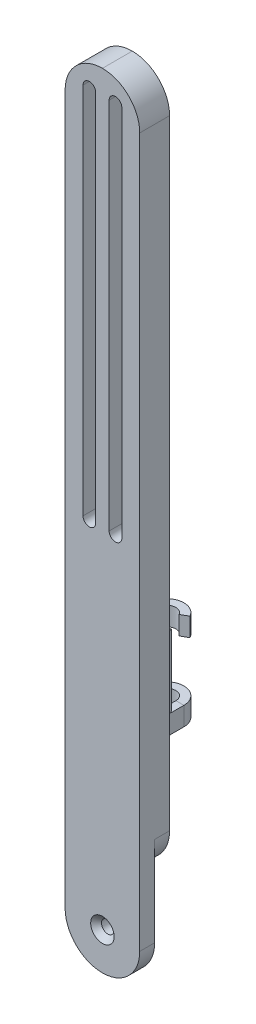
from build123d import *

# Parameters (mm, degrees)
BOSS_EXTRUDE1_DEPTH                                 = 8
FILLET1_R                                           = 10
CUT_EXTRUDE8_DEPTH                                  = 4
CSK_FOR_M3_COUNTERSUNK_FLAT_HEAD_SCREW2_D           = 3.4
CSK_FOR_M3_COUNTERSUNK_FLAT_HEAD_SCREW2_DEPTH       = 8.5
CSK_FOR_M3_COUNTERSUNK_FLAT_HEAD_SCREW2_CSINK_D     = 6.3
CSK_FOR_M3_COUNTERSUNK_FLAT_HEAD_SCREW2_CSINK_ANGLE = 90
CSK_FOR_M3_COUNTERSUNK_FLAT_HEAD_SCREW2_TIP         = 1.021463052
SKETCH14_W                                          = 9
SKETCH14_H                                          = 24.3
BOSS_EXTRUDE2_DEPTH                                 = 2
FILLET3_R                                           = 1.65
BOSS_EXTRUDE3_REACH                                 = 112.905
SKETCH16_W                                          = 2.15
SKETCH16_H                                          = 5
SKETCH18_W                                          = 2.15
SKETCH18_H                                          = 5
CIRPATTERN1_COUNT                                   = 2
CIRPATTERN2_COUNT                                   = 2
CIRPATTERN2_COPY_1_REACH                            = 112.905
CIRPATTERN2_COPY_1_SKETCH_W                         = 2.15
CIRPATTERN2_COPY_1_SKETCH_H                         = 5
CIRPATTERN2_COPY_2_SKETCH_W                         = 2.15
CIRPATTERN2_COPY_2_SKETCH_H                         = 5
FILLET3_OF_CIRPATTERN2_R                            = 1.65


with BuildPart() as part:
    # Sketch1 → Boss-Extrude1 (new body)
    with BuildSketch(Plane(origin=(0, 0, 0), x_dir=(0, 1, 0), z_dir=(0, 0, 1))):
        with BuildLine():
            Line((100, -10), (-100, -10))
            ThreePointArc((-100, -10), (-110, 0), (-100, 10))
            Line((-100, 10), (100, 10))
            Line((100, 10), (100, -10))
        make_face()
        with BuildLine():
            Line((-6.5, 5.2), (93.5, 5.2))
            ThreePointArc((93.5, 5.2), (95.2, 3.5), (93.5, 1.8))
            Line((93.5, 1.8), (-6.5, 1.8))
            ThreePointArc((-6.5, 1.8), (-8.2, 3.5), (-6.5, 5.2))
        make_face(mode=Mode.SUBTRACT)
        with BuildLine():
            Line((-6.5, -1.8), (93.5, -1.8))
            ThreePointArc((93.5, -1.8), (95.2, -3.5), (93.5, -5.2))
            Line((93.5, -5.2), (-6.5, -5.2))
            ThreePointArc((-6.5, -5.2), (-8.2, -3.5), (-6.5, -1.8))
        make_face(mode=Mode.SUBTRACT)
    extrude(amount=BOSS_EXTRUDE1_DEPTH)

    # Fillet1
    fillet1_edges = [part.edges().sort_by_distance(p)[0] for p in [
        (-10, 100, 4),
        (10, 100, 4),
    ]]
    fillet(fillet1_edges, radius=FILLET1_R - 0.0001)  # a hair under: the kernel refuses the full size

    # Sketch8 → Cut-Extrude8 (cut)
    with BuildSketch(Plane(origin=(0, 0, 0), x_dir=(1, 0, 0), z_dir=(0, 0, -1))):
        with BuildLine():
            Line((-10, 76), (-10, 110))
            Line((-10, 110), (10, 110))
            Line((10, 110), (10, 76))
            ThreePointArc((10, 76), (0, 86), (-10, 76))
        make_face()
    extrude(amount=-CUT_EXTRUDE8_DEPTH, mode=Mode.SUBTRACT)

    # CSK for M3 Countersunk Flat Head Screw2
    with Locations(Plane.XY.offset(8)):
        with Locations((0, -100)):
            CounterSinkHole(CSK_FOR_M3_COUNTERSUNK_FLAT_HEAD_SCREW2_D / 2, CSK_FOR_M3_COUNTERSUNK_FLAT_HEAD_SCREW2_CSINK_D / 2, depth=CSK_FOR_M3_COUNTERSUNK_FLAT_HEAD_SCREW2_DEPTH, counter_sink_angle=CSK_FOR_M3_COUNTERSUNK_FLAT_HEAD_SCREW2_CSINK_ANGLE)
            with Locations((0, 0, -(CSK_FOR_M3_COUNTERSUNK_FLAT_HEAD_SCREW2_DEPTH + CSK_FOR_M3_COUNTERSUNK_FLAT_HEAD_SCREW2_TIP / 2))):  # 118° drill point
                Cone(0, CSK_FOR_M3_COUNTERSUNK_FLAT_HEAD_SCREW2_D / 2, CSK_FOR_M3_COUNTERSUNK_FLAT_HEAD_SCREW2_TIP, mode=Mode.SUBTRACT)

    # Sketch14 → Boss-Extrude2 (add)
    with BuildSketch(Plane.XY):
        with Locations((-5, -22.85)):
            Rectangle(SKETCH14_W, SKETCH14_H)
    boss_extrude2 = extrude(amount=-BOSS_EXTRUDE2_DEPTH)

    # Fillet3
    fillet3_edges = [part.edges().sort_by_distance(p)[0] for p in [
        (-5, -35, -2),
        (-9.5, -22.85, -2),
        (-5, -10.7, -2),
        (-0.5, -22.85, -2),
    ]]
    fillet(fillet3_edges, radius=FILLET3_R)

    # Boss-Extrude3: up to this face of the body (flat: up to its plane)
    boss_extrude3_end = Plane(part.part.faces().sort_by_distance((0.402421267, 0.024510411, 0))[0])
    # Sketch16 → Boss-Extrude3 (add, up to the picked face)
    with BuildSketch(Plane.XY.offset(-2), mode=Mode.PRIVATE) as boss_extrude3_sk1:
        with Locations((-1.575, -32.5)):
            Rectangle(SKETCH16_W, SKETCH16_H)
    boss_extrude3_tool1 = split(extrude(boss_extrude3_sk1.sketch, amount=BOSS_EXTRUDE3_REACH, mode=Mode.PRIVATE), bisect_by=boss_extrude3_end, keep=Keep.BOTH, mode=Mode.PRIVATE)
    boss_extrude3 = boss_extrude3_tool1.solids().sort_by(Axis((-1.575, -32.5, -2), (0, 0, 1)))[0]
    add(boss_extrude3)

    # Sweep3: sweep along a path in Sketch17
    with BuildLine(Plane(origin=(0, -33.35, 0), x_dir=(-1, 0, 0), z_dir=(0, -1, 0))) as sweep3_path:
        Line((2.65, 2), (2.65, 4.35))
        ThreePointArc((2.65, 4.35), (4.405679741, 6.623605821), (7.049390153, 5.5))
    # Sketch18 → Sweep3 (sweep)
    with BuildSketch(Plane.XY.offset(-2)):
        with Locations((-1.575, -32.5)):
            Rectangle(SKETCH18_W, SKETCH18_H)
    sweep3 = sweep(path=sweep3_path.line)

    # CirPattern1: Boss-Extrude3, Sweep3 ×2 about axis
    cirpattern1_axis = Axis((-5, -22.85, 0), (0, 0, 1))
    add([boss_extrude3.rotate(cirpattern1_axis, i * 360 / CIRPATTERN1_COUNT) for i in range(1, CIRPATTERN1_COUNT)])
    add([sweep3.rotate(cirpattern1_axis, i * 360 / CIRPATTERN1_COUNT) for i in range(1, CIRPATTERN1_COUNT)])

    # CirPattern2: Boss-Extrude2, Boss-Extrude3, Sweep3 ×2 about axis
    cirpattern2_axis = Axis((0, -32.5, 0), (0, 0, 1))
    add([boss_extrude2.rotate(cirpattern2_axis, i * 360 / CIRPATTERN2_COUNT) for i in range(1, CIRPATTERN2_COUNT)])
    add([boss_extrude3.rotate(cirpattern2_axis, i * 360 / CIRPATTERN2_COUNT) for i in range(1, CIRPATTERN2_COUNT)])
    add([sweep3.rotate(cirpattern2_axis, i * 360 / CIRPATTERN2_COUNT) for i in range(1, CIRPATTERN2_COUNT)])

    # CirPattern2 copy 1: up to this face of the body (flat: up to its plane)
    cirpattern2_copy_1_end = Plane(part.part.faces().sort_by_distance((10.402421267, -19.275489589, 0))[0])
    # CirPattern2 copy 1 sketch → CirPattern2 copy 1 (add, up to the picked face)
    with BuildSketch(Plane(origin=(10, -19.3, -2), x_dir=(1, 0, 0), z_dir=(0, 0, 1)), mode=Mode.PRIVATE) as cirpattern2_copy_1_sk1:
        with Locations((-1.575, -32.5)):
            Rectangle(CIRPATTERN2_COPY_1_SKETCH_W, CIRPATTERN2_COPY_1_SKETCH_H)
    cirpattern2_copy_1_tool1 = split(extrude(cirpattern2_copy_1_sk1.sketch, amount=CIRPATTERN2_COPY_1_REACH, mode=Mode.PRIVATE), bisect_by=cirpattern2_copy_1_end, keep=Keep.BOTH, mode=Mode.PRIVATE)
    add(cirpattern2_copy_1_tool1.solids().sort_by(Axis((8.425, -51.8, -2), (0, 0, 1)))[0])

    # CirPattern2 copy 2: sweep along a path in CirPattern2 copy 2 path
    with BuildLine(Plane(origin=(10, -52.65, 0), x_dir=(-1, 0, 0), z_dir=(0, -1, 0))) as cirpattern2_copy_2_path:
        Line((2.65, 2), (2.65, 4.35))
        ThreePointArc((2.65, 4.35), (4.405679741, 6.623605821), (7.049390153, 5.5))
    # CirPattern2 copy 2 sketch → CirPattern2 copy 2 (sweep)
    with BuildSketch(Plane(origin=(10, -19.3, -2), x_dir=(1, 0, 0), z_dir=(0, 0, 1))):
        with Locations((-1.575, -32.5)):
            Rectangle(CIRPATTERN2_COPY_2_SKETCH_W, CIRPATTERN2_COPY_2_SKETCH_H)
    sweep(path=cirpattern2_copy_2_path.line)

    # Fillet3 of CirPattern2
    fillet3_of_cirpattern2_edges = [part.edges().sort_by_distance(p)[0] for p in [
        (5, -30, -2),
        (9.5, -42.15, -2),
        (5, -54.3, -2),
        (0.5, -42.15, -2),
    ]]
    fillet(fillet3_of_cirpattern2_edges, radius=FILLET3_OF_CIRPATTERN2_R)


solid = part.part
